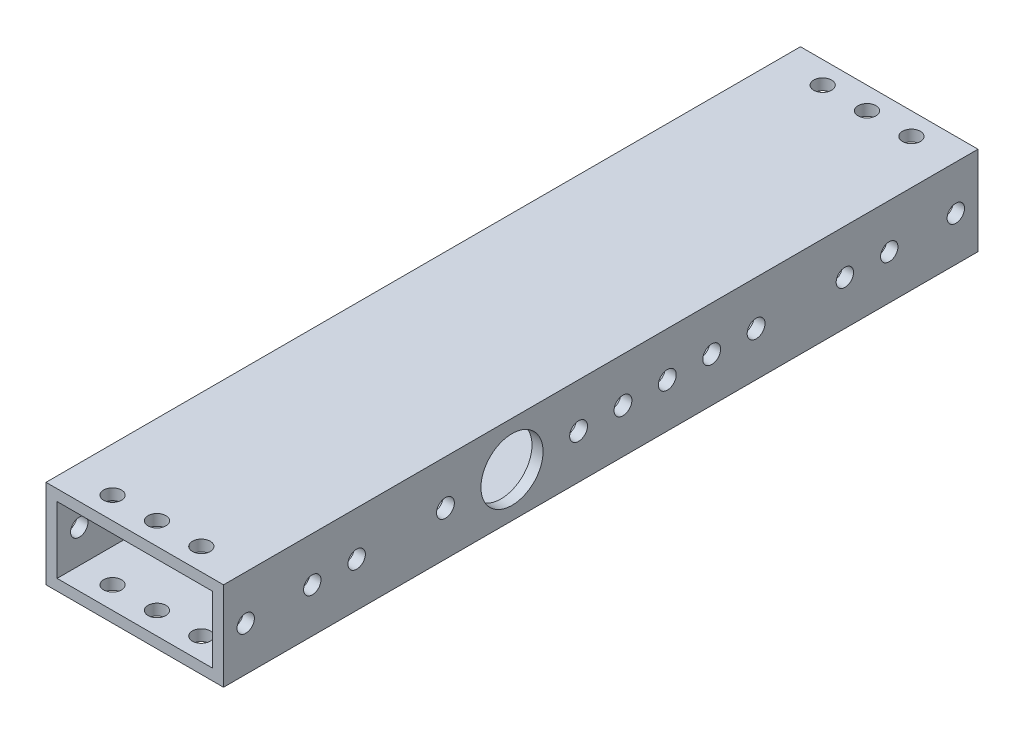
from build123d import *

# Parameters (mm, degrees)
SKETCH1_W           = 50.8
SKETCH1_H           = 25.4
SKETCH1_W_2         = 44.45
SKETCH1_H_2         = 19.05
BOSS_EXTRUDE1_DEPTH = 107.95
SKETCH3_R           = 2.5527
CUT_EXTRUDE2_DEPTH  = 114.769602707
SKETCH4_R           = 8.89
SKETCH4_R_2         = 2.5527
CUT_EXTRUDE3_DEPTH  = 120.979717036
SKETCH2_R           = 2.4892
CUT_EXTRUDE1_DEPTH  = 120.979717036
CUT_EXTRUDE4_REACH  = 115.77
SKETCH5_R           = 2.4892
CUT_EXTRUDE5_REACH  = 121.98
SKETCH7_R           = 2.5527


with BuildPart() as part:
    # Sketch1 → Boss-Extrude1 (new, symmetric)
    with BuildSketch(Plane.XY):
        Rectangle(SKETCH1_W, SKETCH1_H)
        Rectangle(SKETCH1_W_2, SKETCH1_H_2, mode=Mode.SUBTRACT)
    extrude(amount=BOSS_EXTRUDE1_DEPTH, both=True)

    # Sketch3 → Cut-Extrude2 (cut, through all)
    with BuildSketch(Plane(origin=(0, 12.7, 0), x_dir=(1, 0, 0), z_dir=(0, 1, 0))):
        with Locations((-12.7, -101.6)):
            Circle(SKETCH3_R)
        with Locations((0, -101.6)):
            Circle(SKETCH3_R)
        with Locations((12.7, -101.6)):
            Circle(SKETCH3_R)
        with Locations((12.7, 101.6)):
            Circle(SKETCH3_R)
        with Locations((0, 101.6)):
            Circle(SKETCH3_R)
        with Locations((-12.7, 101.6)):
            Circle(SKETCH3_R)
    extrude(amount=-CUT_EXTRUDE2_DEPTH, mode=Mode.SUBTRACT)

    # Sketch4 → Cut-Extrude3 (cut, through all)
    with BuildSketch(Plane(origin=(25.4, 0, 0), x_dir=(0, 0, -1), z_dir=(1, 0, 0))):
        with Locations((-25.4, 0)):
            Circle(SKETCH4_R)
        with Locations((31.75, 0)):
            Circle(SKETCH4_R_2)
        with Locations((19.05, 0)):
            Circle(SKETCH4_R_2)
    extrude(amount=-CUT_EXTRUDE3_DEPTH, mode=Mode.SUBTRACT)

    # Sketch2 → Cut-Extrude1 (cut, through all)
    with BuildSketch(Plane(origin=(25.4, 0, 0), x_dir=(0, 0, -1), z_dir=(1, 0, 0))):
        with Locations((-101.6, 0)):
            Circle(SKETCH2_R)
        with Locations((101.6, 0)):
            Circle(SKETCH2_R)
        with Locations((-82.55, 0)):
            Circle(SKETCH2_R)
        with Locations((-69.85, 0)):
            Circle(SKETCH2_R)
        with Locations((69.85, 0)):
            Circle(SKETCH2_R)
        with Locations((82.55, 0)):
            Circle(SKETCH2_R)
    extrude(amount=-CUT_EXTRUDE1_DEPTH, mode=Mode.SUBTRACT)

    # Sketch5 → Cut-Extrude4 (cut, up to next)
    with BuildSketch(Plane.XZ.offset(12.7), mode=Mode.PRIVATE) as cut_extrude4_sk1:
        with Locations((-3.81, 69.85)):
            Circle(SKETCH5_R)
    cut_extrude4_tool1 = extrude(cut_extrude4_sk1.sketch, amount=-CUT_EXTRUDE4_REACH, mode=Mode.PRIVATE) & part.part
    # Sketch5 → Cut-Extrude4 (cut, up to next)
    with BuildSketch(Plane.XZ.offset(12.7), mode=Mode.PRIVATE) as cut_extrude4_sk2:
        with Locations((-16.51, 69.85)):
            Circle(SKETCH5_R)
    cut_extrude4_tool2 = extrude(cut_extrude4_sk2.sketch, amount=-CUT_EXTRUDE4_REACH, mode=Mode.PRIVATE) & part.part
    # Sketch5 → Cut-Extrude4 (cut, up to next)
    with BuildSketch(Plane.XZ.offset(12.7), mode=Mode.PRIVATE) as cut_extrude4_sk3:
        with Locations((-16.51, 57.15)):
            Circle(SKETCH5_R)
    cut_extrude4_tool3 = extrude(cut_extrude4_sk3.sketch, amount=-CUT_EXTRUDE4_REACH, mode=Mode.PRIVATE) & part.part
    # Sketch5 → Cut-Extrude4 (cut, up to next)
    with BuildSketch(Plane.XZ.offset(12.7), mode=Mode.PRIVATE) as cut_extrude4_sk4:
        with Locations((-3.81, 57.15)):
            Circle(SKETCH5_R)
    cut_extrude4_tool4 = extrude(cut_extrude4_sk4.sketch, amount=-CUT_EXTRUDE4_REACH, mode=Mode.PRIVATE) & part.part
    # Sketch5 → Cut-Extrude4 (cut, up to next)
    with BuildSketch(Plane.XZ.offset(12.7), mode=Mode.PRIVATE) as cut_extrude4_sk5:
        with Locations((-3.81, -6.35)):
            Circle(SKETCH5_R)
    cut_extrude4_tool5 = extrude(cut_extrude4_sk5.sketch, amount=-CUT_EXTRUDE4_REACH, mode=Mode.PRIVATE) & part.part
    # Sketch5 → Cut-Extrude4 (cut, up to next)
    with BuildSketch(Plane.XZ.offset(12.7), mode=Mode.PRIVATE) as cut_extrude4_sk6:
        with Locations((-16.51, -6.35)):
            Circle(SKETCH5_R)
    cut_extrude4_tool6 = extrude(cut_extrude4_sk6.sketch, amount=-CUT_EXTRUDE4_REACH, mode=Mode.PRIVATE) & part.part
    # Sketch5 → Cut-Extrude4 (cut, up to next)
    with BuildSketch(Plane.XZ.offset(12.7), mode=Mode.PRIVATE) as cut_extrude4_sk7:
        with Locations((-16.51, -19.05)):
            Circle(SKETCH5_R)
    cut_extrude4_tool7 = extrude(cut_extrude4_sk7.sketch, amount=-CUT_EXTRUDE4_REACH, mode=Mode.PRIVATE) & part.part
    # Sketch5 → Cut-Extrude4 (cut, up to next)
    with BuildSketch(Plane.XZ.offset(12.7), mode=Mode.PRIVATE) as cut_extrude4_sk8:
        with Locations((-3.81, -19.05)):
            Circle(SKETCH5_R)
    cut_extrude4_tool8 = extrude(cut_extrude4_sk8.sketch, amount=-CUT_EXTRUDE4_REACH, mode=Mode.PRIVATE) & part.part
    add(cut_extrude4_tool1.solids().sort_by_distance((-3.81, -12.7, 69.85))[0], mode=Mode.SUBTRACT)
    add(cut_extrude4_tool2.solids().sort_by_distance((-16.51, -12.7, 69.85))[0], mode=Mode.SUBTRACT)
    add(cut_extrude4_tool3.solids().sort_by_distance((-16.51, -12.7, 57.15))[0], mode=Mode.SUBTRACT)
    add(cut_extrude4_tool4.solids().sort_by_distance((-3.81, -12.7, 57.15))[0], mode=Mode.SUBTRACT)
    add(cut_extrude4_tool5.solids().sort_by_distance((-3.81, -12.7, -6.35))[0], mode=Mode.SUBTRACT)
    add(cut_extrude4_tool6.solids().sort_by_distance((-16.51, -12.7, -6.35))[0], mode=Mode.SUBTRACT)
    add(cut_extrude4_tool7.solids().sort_by_distance((-16.51, -12.7, -19.05))[0], mode=Mode.SUBTRACT)
    add(cut_extrude4_tool8.solids().sort_by_distance((-3.81, -12.7, -19.05))[0], mode=Mode.SUBTRACT)

    # Sketch7 → Cut-Extrude5 (cut, up to next)
    with BuildSketch(Plane(origin=(25.4, 0, 0), x_dir=(0, 0, -1), z_dir=(1, 0, 0)), mode=Mode.PRIVATE) as cut_extrude5_sk1:
        with Locations((44.45, 0)):
            Circle(SKETCH7_R)
    cut_extrude5_tool1 = extrude(cut_extrude5_sk1.sketch, amount=-CUT_EXTRUDE5_REACH, mode=Mode.PRIVATE) & part.part
    # Sketch7 → Cut-Extrude5 (cut, up to next)
    with BuildSketch(Plane(origin=(25.4, 0, 0), x_dir=(0, 0, -1), z_dir=(1, 0, 0)), mode=Mode.PRIVATE) as cut_extrude5_sk2:
        with Locations((6.35, 0)):
            Circle(SKETCH7_R)
    cut_extrude5_tool2 = extrude(cut_extrude5_sk2.sketch, amount=-CUT_EXTRUDE5_REACH, mode=Mode.PRIVATE) & part.part
    # Sketch7 → Cut-Extrude5 (cut, up to next)
    with BuildSketch(Plane(origin=(25.4, 0, 0), x_dir=(0, 0, -1), z_dir=(1, 0, 0)), mode=Mode.PRIVATE) as cut_extrude5_sk3:
        with Locations((-6.35, 0)):
            Circle(SKETCH7_R)
    cut_extrude5_tool3 = extrude(cut_extrude5_sk3.sketch, amount=-CUT_EXTRUDE5_REACH, mode=Mode.PRIVATE) & part.part
    # Sketch7 → Cut-Extrude5 (cut, up to next)
    with BuildSketch(Plane(origin=(25.4, 0, 0), x_dir=(0, 0, -1), z_dir=(1, 0, 0)), mode=Mode.PRIVATE) as cut_extrude5_sk4:
        with Locations((-44.45, 0)):
            Circle(SKETCH7_R)
    cut_extrude5_tool4 = extrude(cut_extrude5_sk4.sketch, amount=-CUT_EXTRUDE5_REACH, mode=Mode.PRIVATE) & part.part
    add(cut_extrude5_tool1.solids().sort_by_distance((25.4, 0, -44.45))[0], mode=Mode.SUBTRACT)
    add(cut_extrude5_tool2.solids().sort_by_distance((25.4, 0, -6.35))[0], mode=Mode.SUBTRACT)
    add(cut_extrude5_tool3.solids().sort_by_distance((25.4, 0, 6.35))[0], mode=Mode.SUBTRACT)
    add(cut_extrude5_tool4.solids().sort_by_distance((25.4, 0, 44.45))[0], mode=Mode.SUBTRACT)


solid = part.part
